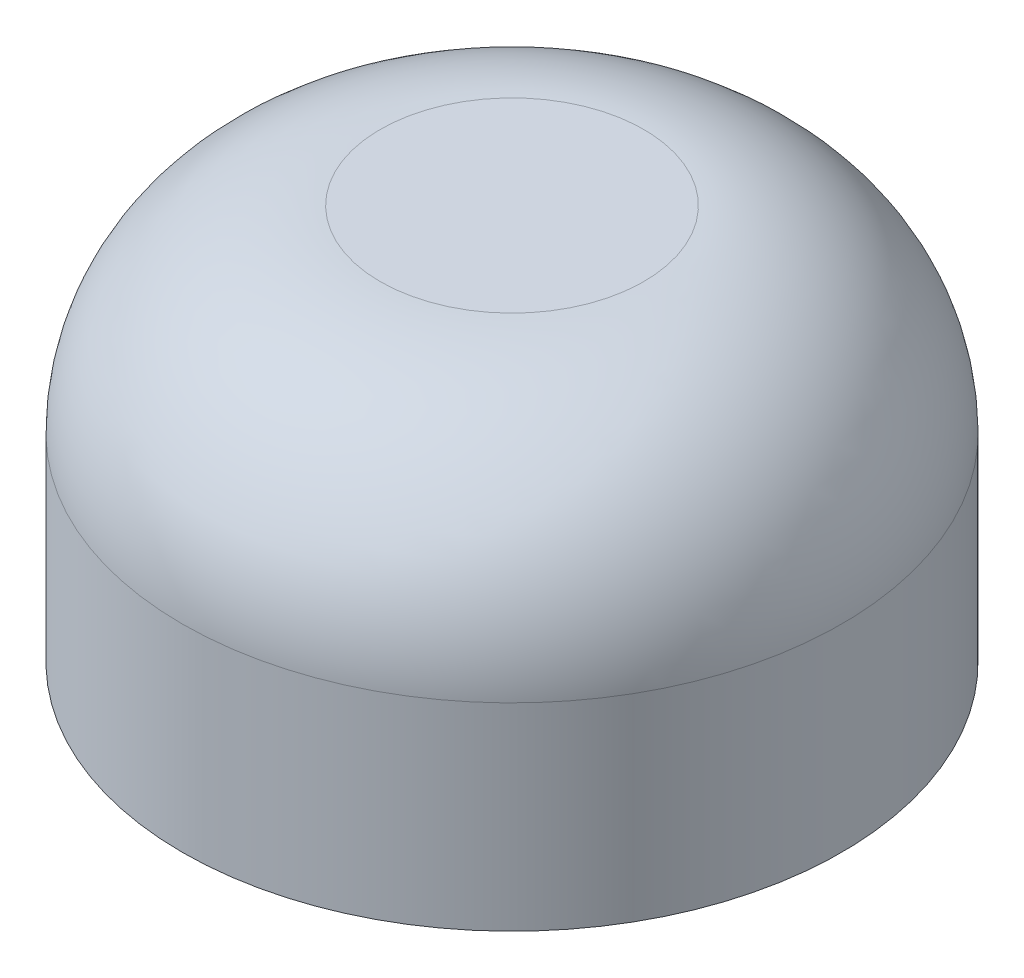
from build123d import *

# Parameters (mm, degrees)
SKETCH1_R           = 10
BOSS_EXTRUDE1_DEPTH = 12
FILLET1_R           = 6


with BuildPart() as part:
    # Sketch1 → Boss-Extrude1 (new body)
    with BuildSketch(Plane(origin=(0, 0, 0), x_dir=(1, 0, 0), z_dir=(0, 1, 0))):
        Circle(SKETCH1_R)
    extrude(amount=BOSS_EXTRUDE1_DEPTH)

    # Fillet1
    fillet1_edges = [part.edges().sort_by_distance(p)[0] for p in [
        (-10, 12, 0),
    ]]
    fillet(fillet1_edges, radius=FILLET1_R)


solid = part.part
